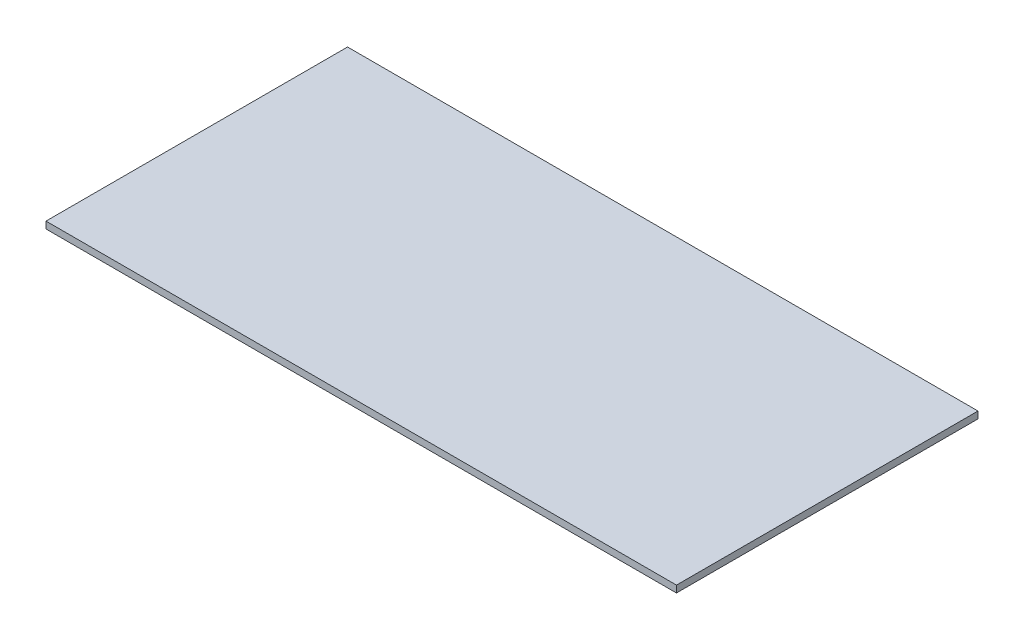
from build123d import *

# Parameters (mm, degrees)
SKETCH1_W           = 584.2
SKETCH1_H           = 279.4
BOSS_EXTRUDE1_DEPTH = 6.35


with BuildPart() as part:
    # Sketch1 → Boss-Extrude1 (new body)
    with BuildSketch(Plane(origin=(0, 0, 0), x_dir=(1, 0, 0), z_dir=(0, 1, 0))):
        with Locations((-170.125376344, -65.643978495)):
            Rectangle(SKETCH1_W, SKETCH1_H)
    extrude(amount=BOSS_EXTRUDE1_DEPTH)


solid = part.part
